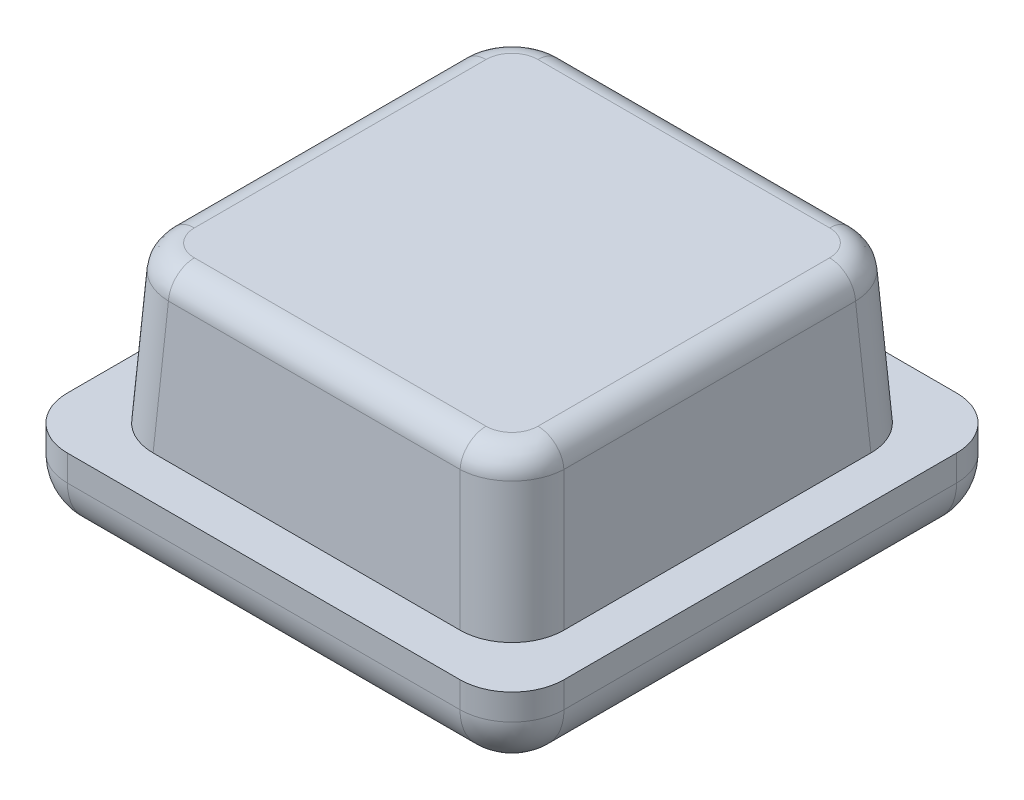
from build123d import *

# Parameters (mm, degrees)
SKETCH1_W           = 19.1
SKETCH1_H           = 19.1
BOSS_EXTRUDE1_DEPTH = 3
FILLET1_R           = 2
FILLET2_R           = 1
FILLET3_R           = 2


with BuildPart() as part:
    # Sketch1 → Boss-Extrude1 (new body)
    with BuildSketch(Plane(origin=(0, 0, 0), x_dir=(1, 0, 0), z_dir=(0, 1, 0))):
        with Locations((9.55, 9.55)):
            Rectangle(SKETCH1_W, SKETCH1_H)
    extrude(amount=BOSS_EXTRUDE1_DEPTH)

    # Sketch2 → Loft1 section 0
    with BuildSketch(Plane(origin=(0, 3, 0), x_dir=(1, 0, 0), z_dir=(0, 1, 0))):
        with BuildLine():
            Line((1.65, 1.65), (17.45, 1.65))
            Line((17.45, 1.65), (17.45, 17.45))
            Line((17.45, 17.45), (1.65, 17.45))
            Line((1.65, 17.45), (1.65, 1.65))
        make_face()
    # Sketch3 → Loft1 section 1
    with BuildSketch(Plane(origin=(0, 9, 0), x_dir=(1, 0, 0), z_dir=(0, 1, 0))):
        with BuildLine():
            Line((2, 2), (17.1, 2))
            Line((17.1, 2), (17.1, 17.1))
            Line((17.1, 17.1), (2, 17.1))
            Line((2, 17.1), (2, 2))
        make_face()
    loft()

    # Fillet1
    fillet1_edges = [part.edges().sort_by_distance(p)[0] for p in [
        (17.275, 6, -1.825),
        (17.275, 6, -17.275),
        (1.825, 6, -17.275),
        (1.825, 6, -1.825),
        (19.1, 1.5, 0),
        (0, 1.5, 0),
        (19.1, 1.5, -19.1),
        (0, 1.5, -19.1),
    ]]
    fillet(fillet1_edges, radius=FILLET1_R)

    # Fillet2
    fillet2_edges = [part.edges().sort_by_distance(p)[0] for p in [
        (2.584382231, 9, -16.515617769),
        (9.55, 9, -17.1),
        (16.515617769, 9, -16.515617769),
        (17.1, 9, -9.55),
        (16.515617769, 9, -2.584382231),
        (9.55, 9, -2),
        (2.584382231, 9, -2.584382231),
        (2, 9, -9.55),
    ]]
    fillet(fillet2_edges, radius=FILLET2_R)

    # Fillet3
    fillet3_edges = [part.edges().sort_by_distance(p)[0] for p in [
        (0.585786438, 0, -0.585786438),
        (0, 0, -9.55),
        (0.585786438, 0, -18.514213562),
        (9.55, 0, -19.1),
        (18.514213562, 0, -18.514213562),
        (19.1, 0, -9.55),
        (18.514213562, 0, -0.585786438),
        (9.55, 0, 0),
    ]]
    fillet(fillet3_edges, radius=FILLET3_R)


solid = part.part
